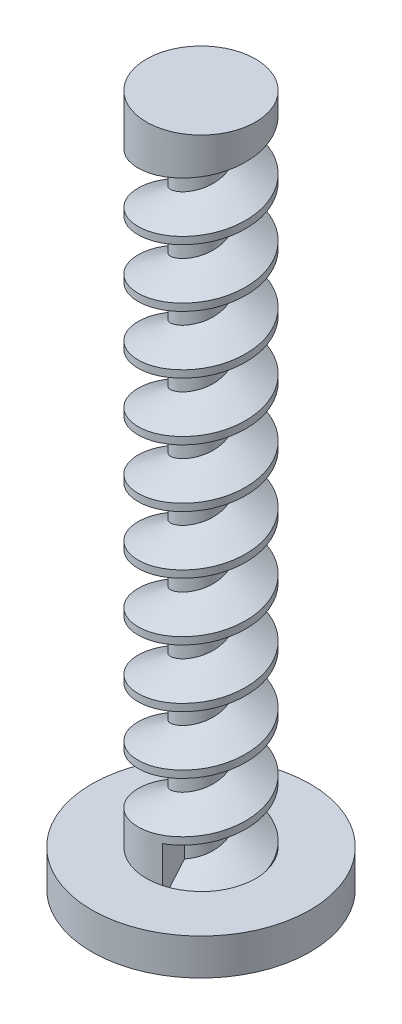
from build123d import *

# Parameters (mm, degrees)
SKETCH1_R           = 1.5
BOSS_EXTRUDE1_DEPTH = 0.5
SKETCH2_R           = 0.75
BOSS_EXTRUDE2_DEPTH = 9
THREAD1_PITCH       = 0.79375
CUT_EXTRUDE1_DEPTH  = 0.4
CUT_EXTRUDE1_DRAFT  = -6


with BuildPart() as part:
    # Sketch1 → Boss-Extrude1 (new body)
    with BuildSketch(Plane(origin=(0, 0, 0), x_dir=(1, 0, 0), z_dir=(0, 1, 0))):
        with Locations(Location((0, 0, 0), (0, 0, 270))):
            Circle(SKETCH1_R)
    extrude(amount=BOSS_EXTRUDE1_DEPTH)

    # Sketch2 → Boss-Extrude2 (add)
    with BuildSketch(Plane(origin=(0, 0.5, 0), x_dir=(1, 0, 0), z_dir=(0, 1, 0))):
        with Locations(Location((0, 0, 0), (0, 0, 270))):
            Circle(SKETCH2_R)
    extrude(amount=BOSS_EXTRUDE2_DEPTH)

    # Thread1: the profile of Thread Profile1 profile screwed along a right-hand helix of 10.708661 turns, 8 arcs to a turn; built about Z, then put on its axis
    thread1_z = Axis((0, 0, 0), (0, 0, 1))
    thread1_corners = [(0.7503, 0, -0.000173205), (0.7503, 0, 0.694704453), (0.320370212, 0, 0.446484374), (0.320370212, 0, 0.248046874)]
    with BuildLine(mode=Mode.PRIVATE) as thread1_profile:
        Line(thread1_corners[0], thread1_corners[1])
        Line(thread1_corners[1], thread1_corners[2])
        Line(thread1_corners[2], thread1_corners[3])
        Line(thread1_corners[3], thread1_corners[0])
    thread1_cap = Face(thread1_profile.wire())
    thread1_turn_angles = [0, 22.5, 45, 67.5, 90, 112.5, 135, 157.5, 180, 202.5, 225, 247.5, 270, 292.5, 315, 337.5, 360]
    thread1_turn_weights = [1, 0.9238795325112867, 1, 0.9238795325112867, 1, 0.9238795325112867, 1, 0.9238795325112867, 1, 0.9238795325112867, 1, 0.9238795325112867, 1, 0.9238795325112867, 1, 0.9238795325112867, 1]
    thread1_turn_rails = [Edge.make_bspline([Vector(p[0], p[1], 0).rotate(thread1_z, thread1_turn_angles[k]) / thread1_turn_weights[k] + Vector(0, 0, p[2] + THREAD1_PITCH * thread1_turn_angles[k] / 360) for k in range(17)], [0, 0, 0, 1, 1, 2, 2, 3, 3, 4, 4, 5, 5, 6, 6, 7, 7, 8, 8, 8], 2, thread1_turn_weights) for p in thread1_corners]
    thread1_turn_sides = [Face.make_surface_from_curves(thread1_turn_rails[p[0]], thread1_turn_rails[p[1]]) for p in [(0, 1), (1, 2), (2, 3), (3, 0)]]
    thread1_last_angles = [3600, 3622.5, 3645, 3667.5, 3690, 3712.5, 3735, 3757.5, 3780, 3802.5, 3825, 3840.059055118, 3855.118110236]
    thread1_last_weights = [1, 0.9238795325112867, 1, 0.9238795325112867, 1, 0.9238795325112867, 1, 0.9238795325112867, 1, 0.9238795325112867, 1, 0.9656585468503884, 1]
    thread1_last_rails = [Edge.make_bspline([Vector(p[0], p[1], 0).rotate(thread1_z, thread1_last_angles[k]) / thread1_last_weights[k] + Vector(0, 0, p[2] + THREAD1_PITCH * thread1_last_angles[k] / 360) for k in range(13)], [0, 0, 0, 1, 1, 2, 2, 3, 3, 4, 4, 5, 5, 6, 6, 6], 2, thread1_last_weights) for p in thread1_corners]
    thread1_last_sides = [Face.make_surface_from_curves(thread1_last_rails[p[0]], thread1_last_rails[p[1]]) for p in [(0, 1), (1, 2), (2, 3), (3, 0)]]
    thread1 = Plane(origin=(0, 9.5, 0), x_dir=(-1, 0, 0), z_dir=(0, -1, 0)) * Solid(Shell([*[p.moved(Location((0, 0, THREAD1_PITCH * i))) for i in range(10) for p in thread1_turn_sides], *thread1_last_sides, thread1_cap, thread1_cap.rotate(thread1_z, 3855.118110236).moved(Location((0, 0, THREAD1_PITCH * 3855.118110236 / 360)))]))
    add(thread1, mode=Mode.SUBTRACT)


with BuildPart() as cut_extrude1_tool:
    # Sketch6 → Cut-Extrude1 (with draft: the straight prism first)
    with BuildSketch(Plane.XZ):
        with BuildLine():
            ThreePointArc((-0.08601914, -1.085014158), (0, -1.171033299), (0.08601914, -1.085014158))
            Line((0.08601914, -1.085014158), (0.08601914, 1.085014158))
            ThreePointArc((0.08601914, 1.085014158), (0, 1.171033299), (-0.08601914, 1.085014158))
            Line((-0.08601914, 1.085014158), (-0.08601914, -1.085014158))
        make_face()
    extrude(amount=-CUT_EXTRUDE1_DEPTH)
    # Cut-Extrude1: the draft: its side faces are tilted about the plane it starts from
    cut_extrude1_sides = [cut_extrude1_tool.faces().sort_by_distance(p)[0] for p in [
        (0, 0.2, -1.171033299),
        (0.08601914, 0.2, 0),
        (0, 0.2, 1.171033299),
        (-0.08601914, 0.2, 0),
    ]]
    draft(cut_extrude1_sides, Plane.XZ, CUT_EXTRUDE1_DRAFT)


with BuildPart() as part_1:
    add(part.part)

    # Cut-Extrude1: cut by cut_extrude1_tool
    add(cut_extrude1_tool.part, mode=Mode.SUBTRACT)


solid = part_1.part
